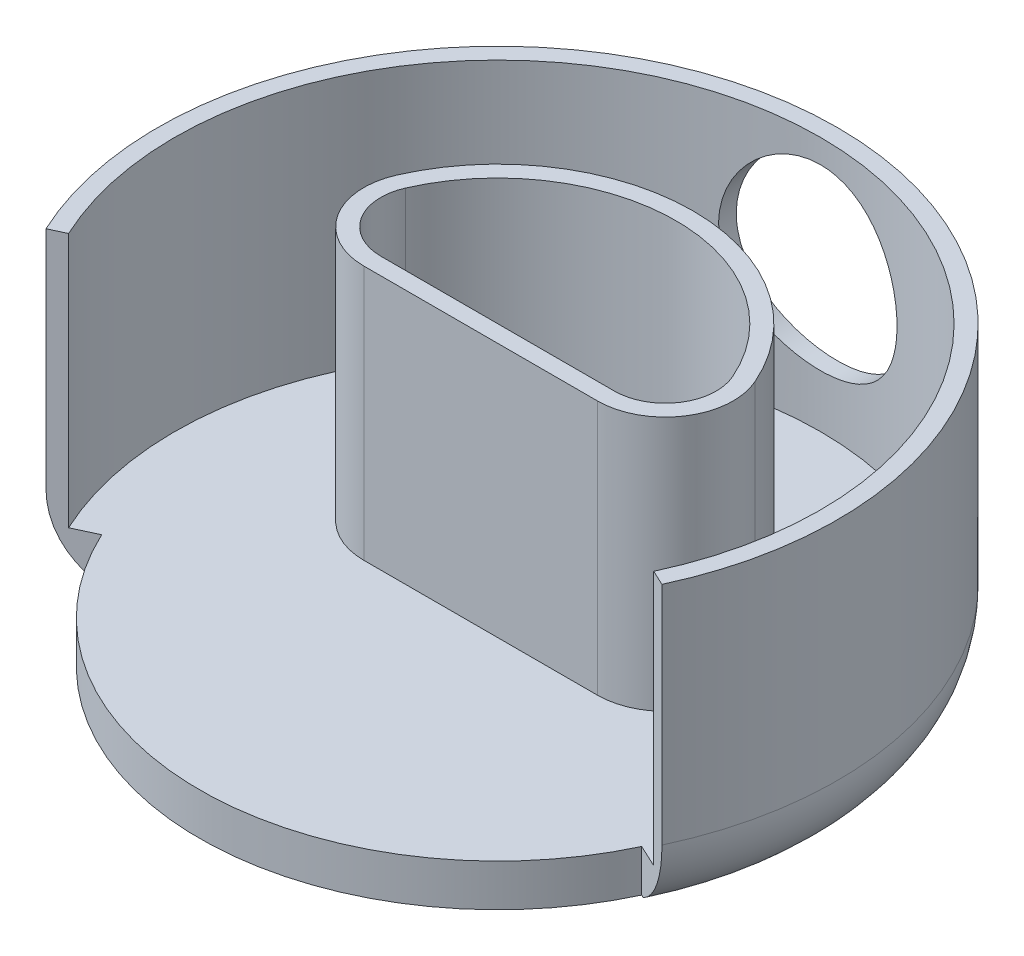
from build123d import *

# Parameters (mm, degrees)
CUT_EXTRUDE3_DEPTH           = 60
CUT_EXTRUDE5_DEPTH           = 2
CUT_EXTRUDE5_DEPTH_BACK      = 30
SKETCH9_R                    = 38
SKETCH9_R_2                  = 23
SKETCH19_W                   = 12
SKETCH19_H                   = 36.5
CUT_REVOLVE2_ANGLE           = 65
CUT_REVOLVE2_OTHER_WAY_ANGLE = 65
SKETCH21_W                   = 3.25
SKETCH21_H                   = 4
BOSS_EXTRUDE3_DEPTH          = 1.35
CIRPATTERN1_COUNT            = 5
CUT_EXTRUDE9_START           = -5
CUT_EXTRUDE9_DEPTH           = 5
SKETCH23_R                   = 10.5
CUT_EXTRUDE10_DEPTH          = 10
SKETCH24_W                   = 17
SKETCH24_H                   = 12
BOSS_EXTRUDE4_DEPTH          = 8
SKETCH26_W                   = 12
SKETCH26_H                   = 8
CUT_EXTRUDE11_DEPTH          = 10
SKETCH27_W                   = 4
SKETCH27_H                   = 5
CUT_EXTRUDE12_DEPTH          = 5
CUT_EXTRUDE14_DEPTH          = 2
CUT_EXTRUDE14_DEPTH_BACK     = 30
SKETCH29_R                   = 1
CUT_EXTRUDE15_DEPTH          = 15
FILLET1_R                    = 6
FILLET2_R                    = 8
SKETCH30_W                   = 97.703590575
SKETCH30_H                   = 5
CUT_EXTRUDE16_DEPTH          = 5
INTERSECT1_DEPTH             = 20.469057744
INTERSECT1_START             = 55.427876097
INTERSECT1_2_OUTLINE_R       = 40
INTERSECT1_2_OUTLINE_W       = 12
INTERSECT1_2_OUTLINE_H       = 8
INTERSECT1_2_DEPTH           = 8
INTERSECT1_START_2           = 50.427876097
INTERSECT1_3_OUTLINE_W       = 17
INTERSECT1_3_OUTLINE_H       = 12
INTERSECT1_3_OUTLINE_W_2     = 12
INTERSECT1_3_OUTLINE_H_2     = 8
INTERSECT1_3_DEPTH           = 5


with BuildPart() as part:
    # Sketch1 → Revolve1 (revolve)
    with BuildSketch(Plane.XY, mode=Mode.PRIVATE) as revolve1_sk:
        with BuildLine():
            Line((0, 63.427876097), (32, 63.427876097))
            ThreePointArc((32, 63.427876097), (37.656854249, 61.084730346), (40, 55.427876097))
            Line((40, 55.427876097), (40, 28.846818009))
            ThreePointArc((40, 28.846818009), (38.792081772, 24.082439968), (35.460140376, 20.469057744))
            Line((35.460140376, 20.469057744), (28.539859624, 15.958818353))
            ThreePointArc((28.539859624, 15.958818353), (25.207918228, 12.345436129), (24, 7.581058088))
            Line((24, 7.581058088), (24, 3.25))
            Line((24, 3.25), (24.35, 3))
            Line((24.35, 3), (24.35, 0))
            Line((24.35, 0), (22.5, 0))
            Line((22.5, 0), (22.5, 12.5))
            ThreePointArc((22.5, 12.5), (22.353553391, 12.853553391), (22, 13))
            Line((22, 13), (0, 13))
            Line((0, 13), (0, 63.427876097))
        make_face()
    revolve(revolve1_sk.sketch.rotate(Axis((0, 0, 0), (0, 1, 0)), 90), axis=Axis((0, 0, 0), (0, 1, 0)))

    # Sketch11 → Cut-Extrude3 (cut)
    with BuildSketch(Plane(origin=(0, 13, 0), x_dir=(-1, 0, 0), z_dir=(0, -1, 0))):
        with BuildLine():
            Line((-21, 0), (21, 0))
            ThreePointArc((21, 0), (0, 21), (-21, 0))
        make_face()
    extrude(amount=-CUT_EXTRUDE3_DEPTH, mode=Mode.SUBTRACT)

    # Sketch9 → Cut-Extrude5 (cut, two sides: drawn at the far end of the back side and taken through both)
    with BuildSketch(Plane(origin=(0, 55.427876097, 0), x_dir=(1, 0, 0), z_dir=(0, 1, 0)).offset(-CUT_EXTRUDE5_DEPTH_BACK)):
        with Locations(Location((0, 0, 0), (0, 0, 270))):
            Circle(SKETCH9_R)
        with Locations(Location((0, 0, 0), (0, 0, 270))):
            Circle(SKETCH9_R_2, mode=Mode.SUBTRACT)
    extrude(amount=CUT_EXTRUDE5_DEPTH + CUT_EXTRUDE5_DEPTH_BACK, mode=Mode.SUBTRACT)

    # Sketch19 → Cut-Revolve2 (revolve, cut)
    with BuildSketch(Plane(origin=(0, 0, 0), x_dir=(0, 0, -1), z_dir=(1, 0, 0))):
        with Locations((-41.064715832, 37.177876097)):
            Rectangle(SKETCH19_W, SKETCH19_H)
    revolve(axis=Axis((0, 0, 0), (0, 1, 0)), revolution_arc=CUT_REVOLVE2_ANGLE, mode=Mode.SUBTRACT)

    # Sketch19 → Cut-Revolve2 other way (revolve, cut)
    with BuildSketch(Plane(origin=(0, 0, 0), x_dir=(0, 0, -1), z_dir=(1, 0, 0))):
        with Locations((-41.064715832, 37.177876097)):
            Rectangle(SKETCH19_W, SKETCH19_H)
    revolve(axis=Axis((0, 0, 0), (0, -1, 0)), revolution_arc=CUT_REVOLVE2_OTHER_WAY_ANGLE, mode=Mode.SUBTRACT)

    # Sketch21 → Boss-Extrude3 (add)
    with BuildSketch(Plane(origin=(0, 0, 22.5), x_dir=(-1, 0, 0), z_dir=(0, 0, -1))):
        with Locations((0, 2)):
            Rectangle(SKETCH21_W, SKETCH21_H)
    boss_extrude3 = extrude(amount=BOSS_EXTRUDE3_DEPTH)

    # CirPattern1: Boss-Extrude3 ×5 about axis
    cirpattern1_axis = Axis((0, 0, 0), (0, 1, 0))
    for i in range(1, CIRPATTERN1_COUNT):
        add(boss_extrude3.rotate(cirpattern1_axis, i * 360 / CIRPATTERN1_COUNT))

    # Cut-Extrude9: read off the stored shape, not the designer's step
    # Cut-Extrude9 outline → Cut-Extrude9 (cut)
    with BuildSketch(Plane(origin=(0, 63.427876097, 0), x_dir=(1, 0, 0), z_dir=(0, 1, 0)).offset(CUT_EXTRUDE9_START)):
        with BuildLine():
            ThreePointArc((40, 0), (0, 40), (-40, 0))
            Line((-40, 0), (-21, 0))
            ThreePointArc((-21, 0), (0, 21), (21, 0))
            Line((21, 0), (40, 0))
        make_face()
    extrude(amount=CUT_EXTRUDE9_DEPTH, mode=Mode.SUBTRACT)

    # Sketch23 → Cut-Extrude10 (cut)
    with BuildSketch(Plane(origin=(0, 0, -40), x_dir=(-1, 0, 0), z_dir=(0, 0, -1))):
        with Locations((0, 42.137876097)):
            Circle(SKETCH23_R)
    extrude(amount=-CUT_EXTRUDE10_DEPTH, mode=Mode.SUBTRACT)

    # Sketch24 → Boss-Extrude4 (add)
    with BuildSketch(Plane(origin=(0, 58.427876097, 0), x_dir=(1, 0, 0), z_dir=(0, 1, 0))):
        with Locations((0, 30)):
            Rectangle(SKETCH24_W, SKETCH24_H)
    extrude(amount=-BOSS_EXTRUDE4_DEPTH)

    # Sketch26 → Cut-Extrude11 (cut)
    with BuildSketch(Plane(origin=(0, 58.427876097, 0), x_dir=(1, 0, 0), z_dir=(0, 1, 0))):
        with Locations((0, 30)):
            Rectangle(SKETCH26_W, SKETCH26_H)
    extrude(amount=-CUT_EXTRUDE11_DEPTH, mode=Mode.SUBTRACT)

    # Sketch27 → Cut-Extrude12 (cut)
    with BuildSketch(Plane(origin=(8.5, 0, 0), x_dir=(0, 0, -1), z_dir=(1, 0, 0))):
        with Locations((29.5, 53.927876097)):
            Rectangle(SKETCH27_W, SKETCH27_H)
    extrude(amount=-CUT_EXTRUDE12_DEPTH, mode=Mode.SUBTRACT)

    # Sketch28 → Cut-Extrude14 (cut, two sides: drawn at the far end of the back side and taken through both)
    with BuildSketch(Plane(origin=(0, 55.427876097, 0), x_dir=(1, 0, 0), z_dir=(0, 1, 0)).offset(-CUT_EXTRUDE14_DEPTH_BACK)):
        with BuildLine():
            Line((-22.912878475, -2), (22.912878475, -2))
            ThreePointArc((22.912878475, -2), (0, -23), (-22.912878475, -2))
        make_face()
    extrude(amount=CUT_EXTRUDE14_DEPTH + CUT_EXTRUDE14_DEPTH_BACK, mode=Mode.SUBTRACT)

    # Sketch29 → Cut-Extrude15 (cut)
    with BuildSketch(Plane(origin=(0, 0, 0), x_dir=(-1, 0, 0), z_dir=(0, 0, -1))):
        with Locations((-30.416198487, 60.927876097)):
            Circle(SKETCH29_R)
        with Locations((30.416198487, 60.927876097)):
            Circle(SKETCH29_R)
        with Locations((0, 60.927876097)):
            Circle(SKETCH29_R)
    extrude(amount=-CUT_EXTRUDE15_DEPTH, mode=Mode.SUBTRACT)

    # Fillet1
    fillet1_edges = [part.edges().sort_by_distance(p)[0] for p in [
        (21, 35.713938048, 0),
        (-21, 35.713938048, 0),
    ]]
    fillet(fillet1_edges, radius=FILLET1_R)

    # Fillet2
    fillet2_edges = [part.edges().sort_by_distance(p)[0] for p in [
        (-22.912878475, 41.427876097, 2),
        (22.912878475, 41.427876097, 2),
    ]]
    fillet(fillet2_edges, radius=FILLET2_R)

    # Sketch30 → Cut-Extrude16 (cut)
    with BuildSketch(Plane(origin=(0, 63.427876097, 0), x_dir=(1, 0, 0), z_dir=(0, 1, 0))):
        with Locations((-0.528699084, -2.5)):
            Rectangle(SKETCH30_W, SKETCH30_H)
    extrude(amount=-CUT_EXTRUDE16_DEPTH, mode=Mode.SUBTRACT)

    # Intersect1: read off the stored shape, not the designer's step
    # Intersect1 outline → Intersect1 (cut)
    with BuildSketch(Plane(origin=(0, 0, 0), x_dir=(1, 0, 0), z_dir=(0, 1, 0))):
        with BuildLine():
            Line((31.779425009, -14.818989253), (32.137801352, -14.986102887))
            ThreePointArc((32.137801352, -14.986102887), (0, 35.460140376), (-32.137801352, -14.986102887))
            Line((-32.137801352, -14.986102887), (-31.779425009, -14.818989253))
            ThreePointArc((-31.779425009, -14.818989253), (0, -35.064715832), (31.779425009, -14.818989253))
        make_face()
        with BuildLine():
            ThreePointArc((-13.747727085, 0), (-18.767687244, 2.713664655), (-19.246817919, 8.4))
            ThreePointArc((-19.246817919, 8.4), (0, 21), (19.246817919, 8.4))
            ThreePointArc((19.246817919, 8.4), (18.767687244, 2.713664655), (13.747727085, 0))
            Line((13.747727085, 0), (-13.747727085, 0))
        make_face(mode=Mode.SUBTRACT)
    extrude(amount=INTERSECT1_DEPTH, mode=Mode.SUBTRACT)

    # Intersect1 2 outline → Intersect1 2 (cut)
    with BuildSketch(Plane(origin=(0, 0, 0), x_dir=(1, 0, 0), z_dir=(0, 1, 0)).offset(INTERSECT1_START)):
        Circle(INTERSECT1_2_OUTLINE_R)
        with Locations((0, 30)):
            Rectangle(INTERSECT1_2_OUTLINE_W, INTERSECT1_2_OUTLINE_H, mode=Mode.SUBTRACT)
        with BuildLine():
            ThreePointArc((-13.747727085, 0), (-18.767687244, 2.713664655), (-19.246817919, 8.4))
            ThreePointArc((-19.246817919, 8.4), (0, 21), (19.246817919, 8.4))
            ThreePointArc((19.246817919, 8.4), (18.767687244, 2.713664655), (13.747727085, 0))
            Line((13.747727085, 0), (-13.747727085, 0))
        make_face(mode=Mode.SUBTRACT)
    extrude(amount=INTERSECT1_2_DEPTH, mode=Mode.SUBTRACT)

    # Intersect1 3 outline → Intersect1 3 (cut)
    with BuildSketch(Plane(origin=(0, 0, 0), x_dir=(1, 0, 0), z_dir=(0, 1, 0)).offset(INTERSECT1_START_2)):
        with Locations((0, 30)):
            Rectangle(INTERSECT1_3_OUTLINE_W, INTERSECT1_3_OUTLINE_H)
        with Locations((0, 30)):
            Rectangle(INTERSECT1_3_OUTLINE_W_2, INTERSECT1_3_OUTLINE_H_2, mode=Mode.SUBTRACT)
    extrude(amount=INTERSECT1_3_DEPTH, mode=Mode.SUBTRACT)


solid = part.part
